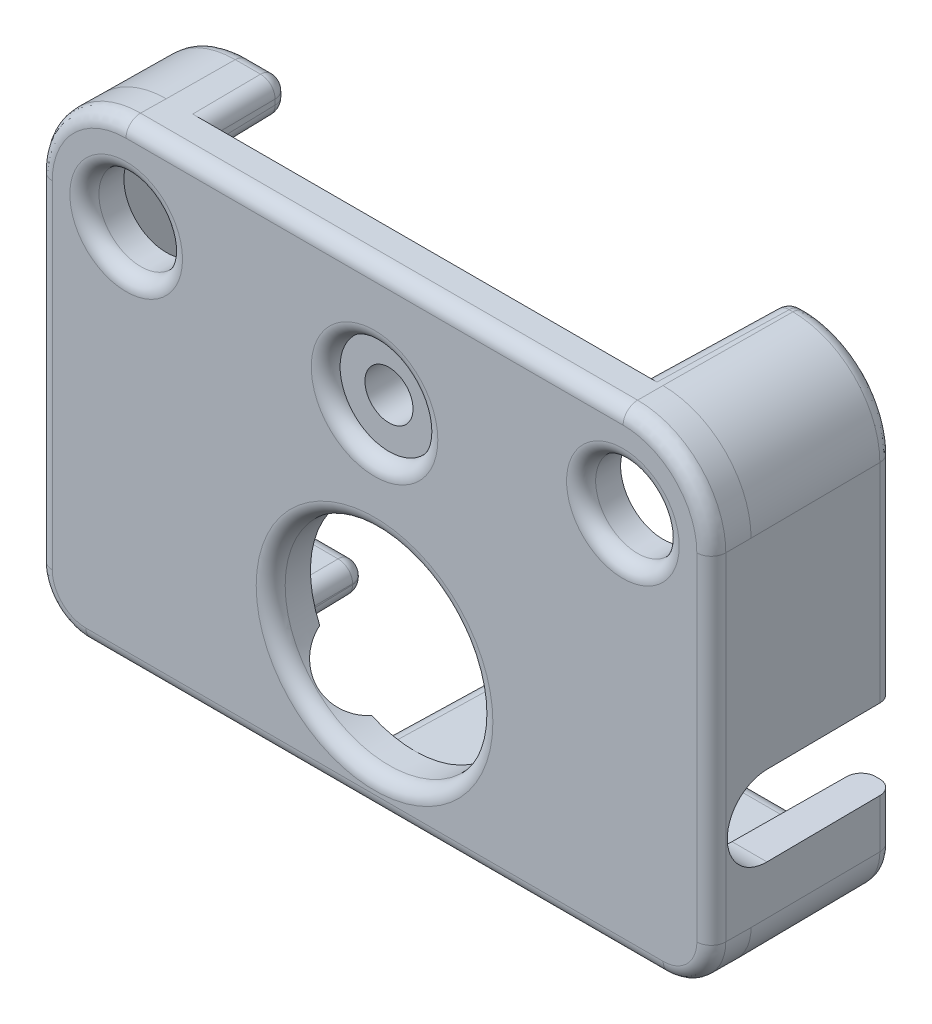
from build123d import *

# Parameters (mm, degrees)
SKETCH1_R                     = 6.5
BOSS_EXTRUDE1_DEPTH           = 2.5
BOSS_EXTRUDE1_DRAFT           = -0.5000000000000011
SKETCH3_W                     = 62.87617342752603
SKETCH3_H                     = 21.84169040460046
CUT_EXTRUDE2_DEPTH            = 30.83426878966247
CUT_EXTRUDE2_DRAFT            = -1.0000000000000022
FILLET1_R                     = 5.5
FILLET2_R                     = 3
BOSS_EXTRUDE3_DEPTH           = 9
BOSS_EXTRUDE3_TAPER           = 0.5000000000000011
CUT_EXTRUDE11_DEPTH           = 32.061770786974705
CUT_EXTRUDE11_DRAFT           = -1.0000000000000022
SKETCH24_R                    = 1.4999999999999996
CUT_EXTRUDE12_DEPTH           = 32.876066333889995
CUT_EXTRUDE6_DEPTH            = 32.061770786974705
CUT_EXTRUDE6_DRAFT            = -1.0000000000000022
SKETCH19_W                    = 16.058890471302547
SKETCH19_H                    = 16.952410483127878
CUT_EXTRUDE13_DEPTH           = 3.8
CUT_EXTRUDE13_DRAFT           = -1.0000000000000022
FILLET9_R                     = 0.9
SKETCH25_R                    = 2.5
CUT_EXTRUDE14_DEPTH           = 32.051093548038764
CIRPATTERN1_COUNT             = 2
CIRPATTERN1_ANGLE             = 135.0000000000001
CUT_EXTRUDE15_DEPTH           = 31.776133778125132
SKETCH29_R                    = 2.5999999999999996
CUT_EXTRUDE16_DEPTH           = 32.865661942427224
CUT_EXTRUDE16_DRAFT           = 1.0000000000000022
SKETCH29_R_2                  = 2.6000000000000005
CUT_EXTRUDE16_PROFILE_2_DEPTH = 32.865661942427224
CUT_EXTRUDE16_PROFILE_2_DRAFT = 1.0000000000000022
FILLET10_R                    = 0.9
BOSS_EXTRUDE4_DEPTH           = 9.7
FILLET11_R                    = 2
SKETCH32_R                    = 2.5000000000000004
SKETCH32_R_2                  = 1.4999999999999996
BOSS_EXTRUDE5_DEPTH           = 0.6
SKETCH33_R                    = 3.05
CUT_EXTRUDE17_DEPTH           = 0.9
FILLET12_R                    = 0.9


# Some blends are built 0.0001 mm under size
with BuildPart() as part:
    # Sketch1 → Boss-Extrude1 (with draft: the straight prism first)
    with BuildSketch(Plane.XY):
        Polygon((20.999999999999993, -20.999999999999996), (20.999999999999993, 21.000000000000004), (-21.000000000000007, 20.999999999999996), (-21.000000000000007, -21.000000000000004), align=None)
        Circle(SKETCH1_R, mode=Mode.SUBTRACT)
    extrude(amount=BOSS_EXTRUDE1_DEPTH)
    # Boss-Extrude1: the draft: its side faces are tilted about the plane it starts from
    boss_extrude1_sides = [part.faces().sort_by_distance(p)[0] for p in [
        (21, 0, 1.25),
        (0, 21, 1.25),
        (-21, 0, 1.25),
        (0, -21, 1.25),
        (-6.5, 0, 1.25),
    ]]
    draft(boss_extrude1_sides, Plane.XY, BOSS_EXTRUDE1_DRAFT)


with BuildPart() as cut_extrude2_tool:
    # Sketch3 → Cut-Extrude2 (with draft: the straight prism first)
    with BuildSketch(Plane.XY.offset(2.5)):
        with Locations((0.8306648912896311, -19.420845202300228)):
            Rectangle(SKETCH3_W, SKETCH3_H)
    extrude(amount=-CUT_EXTRUDE2_DEPTH)
    # Cut-Extrude2: the draft: its side faces are tilted about the plane it starts from
    cut_extrude2_sides = [cut_extrude2_tool.faces().sort_by_distance(p)[0] for p in [
        (-30.607421822, -19.420845202, -12.917134395),
        (0.830664891, -30.341690405, -12.917134395),
        (32.268751605, -19.420845202, -12.917134395),
        (0.830664891, -8.5, -12.917134395),
    ]]
    draft(cut_extrude2_sides, Plane.XY.offset(2.5), CUT_EXTRUDE2_DRAFT)


with BuildPart() as part_1:
    add(part.part)

    # Cut-Extrude2: cut by cut_extrude2_tool
    add(cut_extrude2_tool.part, mode=Mode.SUBTRACT)

    # Fillet1
    fillet1_edges = [part_1.edges().sort_by_distance(p)[0] for p in [
        (-21.01090858473846, 21.010908584738445, 1.25),
        (21.01090858473844, 21.010908584738456, 1.25),
    ]]
    fillet(fillet1_edges, radius=FILLET1_R)

    # Fillet2
    fillet2_edges = [part_1.edges().sort_by_distance(p)[0] for p in [
        (21.010908584738438, -8.52181883116027, 1.2499999999999998),
        (-21.01090858473846, -8.521818831160273, 1.25),
    ]]
    fillet(fillet2_edges, radius=FILLET2_R)

    # Sketch17 → Boss-Extrude3 (add)
    with BuildSketch(Plane(origin=(0, 0, 0), x_dir=(-1, 0, 0), z_dir=(0, 0, -1))):
        with BuildLine():
            Line((-17.999428850311958, -8.543637662320545), (17.999428850311975, -8.543637662320545))
            add(Edge.make_bspline(
                [(17.999428850311975, -8.543637662320545), (21.00000000000001, -8.543637662320545), (21.00000000000001, -5.542723711457656)],
                knots=[0.46354100007527144, 0.46354100007527144, 0.46354100007527144, 2.034489625915063, 2.034489625915063, 2.034489625915063], degree=2, weights=[1, 0.7070529332927252, 1]))
            Line((21.00000000000001, -5.542723711457656), (21.000000000000007, 15.500209423147039))
            add(Edge.make_bspline(
                [(21.000000000000007, 15.500209423147039), (21.000000000000018, 21), (15.500209423147057, 20.999999999999993)],
                knots=[2.356232566403283, 2.356232566403283, 2.356232566403283, 3.9269527407763043, 3.9269527407763043, 3.9269527407763043], degree=2, weights=[1, 0.707133704620916, 1]))
            Line((15.500209423147057, 20.999999999999993), (-15.500209423147053, 21.000000000000004))
            add(Edge.make_bspline(
                [(-15.500209423147053, 21.000000000000004), (-21.000000000000007, 21.000000000000007), (-20.999999999999996, 15.500209423147046)],
                knots=[2.3562325664032837, 2.3562325664032837, 2.3562325664032837, 3.926952740776305, 3.926952740776305, 3.926952740776305], degree=2, weights=[1, 0.707133704620916, 1]))
            Line((-20.999999999999996, 15.500209423147046), (-20.999999999999993, -5.542723711457658))
            add(Edge.make_bspline(
                [(-20.999999999999993, -5.542723711457658), (-20.999999999999996, -8.543637662320549), (-17.999428850311958, -8.543637662320545)],
                knots=[4.248695681264401, 4.248695681264401, 4.248695681264401, 5.819644307104193, 5.819644307104193, 5.819644307104193], degree=2, weights=[1, 0.707052933292725, 1]))
        make_face()
        with BuildLine():
            Line((-17.8, -6.543637662320546), (17.799999999999997, -6.5436376623205454))
            ThreePointArc((17.799999999999997, -6.5436376623205454), (18.507106781186543, -6.250744443507093), (18.799999999999994, -5.5436376623205454))
            Line((18.799999999999994, -5.5436376623205454), (18.79999999999999, 15.500000000000002))
            ThreePointArc((18.79999999999999, 15.500000000000002), (17.8334523779156, 17.833452377915606), (15.499999999999996, 18.800000000000004))
            Line((15.499999999999996, 18.800000000000004), (-15.500000000000004, 18.799999999999997))
            ThreePointArc((-15.500000000000004, 18.799999999999997), (-17.83345237791561, 17.833452377915606), (-18.800000000000008, 15.499999999999998))
            Line((-18.800000000000008, 15.499999999999998), (-18.8, -5.543637662320545))
            ThreePointArc((-18.8, -5.543637662320545), (-18.50710678118655, -6.250744443507093), (-17.8, -6.543637662320546))
        make_face(mode=Mode.SUBTRACT)
    extrude(amount=BOSS_EXTRUDE3_DEPTH, taper=BOSS_EXTRUDE3_TAPER)


with BuildPart() as cut_extrude11_tool:
    # Sketch23 → Cut-Extrude11 (with draft: the straight prism first)
    with BuildSketch(Plane(origin=(0, 0, 0), x_dir=(-1, 0, 0), z_dir=(0, 0, -1))):
        Polygon((2.085641741126999, -2.299063723318845), (2.085641741126999, -11.23940247514184), (11.845349376722023, -11.23940247514184), (11.845349376722021, -2.299063723318845), align=None)
    extrude(amount=CUT_EXTRUDE11_DEPTH)
    # Cut-Extrude11: the draft: its side faces are tilted about the plane it starts from
    cut_extrude11_sides = [cut_extrude11_tool.faces().sort_by_distance(p)[0] for p in [
        (-2.085641741, -6.769233099, -16.030885393),
        (-6.965495559, -11.239402475, -16.030885393),
        (-11.845349377, -6.769233099, -16.030885393),
        (-6.965495559, -2.299063723, -16.030885393),
    ]]
    draft(cut_extrude11_sides, Plane(origin=(0, 0, 0), x_dir=(-1, 0, 0), z_dir=(0, 0, -1)), CUT_EXTRUDE11_DRAFT)


with BuildPart() as part_2:
    add(part_1.part)

    # Cut-Extrude11: cut by cut_extrude11_tool
    add(cut_extrude11_tool.part, mode=Mode.SUBTRACT)

    # Sketch24 → Cut-Extrude12 (cut, through all)
    with BuildSketch(Plane.XY.offset(2.5)):
        with Locations((0, 13.535319355800587)):
            Circle(SKETCH24_R)
    extrude(amount=-CUT_EXTRUDE12_DEPTH, mode=Mode.SUBTRACT)


with BuildPart() as cut_extrude6_tool:
    # Sketch18 → Cut-Extrude6 (with draft: the straight prism first)
    with BuildSketch(Plane(origin=(0, 0, 0), x_dir=(-1, 0, 0), z_dir=(0, 0, -1))):
        Polygon((-14.22547683463904, 22.291876231555076), (-14.22547683463904, 18.35826976556179), (12.949356305694632, 18.35826976556179), (12.949356305694634, 22.291876231555076), align=None)
    extrude(amount=CUT_EXTRUDE6_DEPTH)
    # Cut-Extrude6: the draft: its side faces are tilted about the plane it starts from
    cut_extrude6_sides = [cut_extrude6_tool.faces().sort_by_distance(p)[0] for p in [
        (14.225476835, 20.325072999, -16.030885393),
        (0.638060264, 18.358269766, -16.030885393),
        (-12.949356306, 20.325072999, -16.030885393),
        (0.638060264, 22.291876232, -16.030885393),
    ]]
    draft(cut_extrude6_sides, Plane(origin=(0, 0, 0), x_dir=(-1, 0, 0), z_dir=(0, 0, -1)), CUT_EXTRUDE6_DRAFT)


with BuildPart() as part_3:
    add(part_2.part)

    # Cut-Extrude6: cut by cut_extrude6_tool
    add(cut_extrude6_tool.part, mode=Mode.SUBTRACT)


with BuildPart() as cut_extrude13_tool:
    # Sketch19 → Cut-Extrude13 (with draft: the straight prism first)
    with BuildSketch(Plane(origin=(0, 0, -5.2), x_dir=(-1, 0, 0), z_dir=(0, 0, -1))):
        with Locations((19.44387887215296, 17.095333041325667)):
            Rectangle(SKETCH19_W, SKETCH19_H)
    extrude(amount=CUT_EXTRUDE13_DEPTH)
    # Cut-Extrude13: the draft: its side faces are tilted about the plane it starts from
    cut_extrude13_sides = [cut_extrude13_tool.faces().sort_by_distance(p)[0] for p in [
        (-11.414433637, 17.095333041, -7.1),
        (-19.443878872, 8.6191278, -7.1),
        (-27.473324108, 17.095333041, -7.1),
        (-19.443878872, 25.571538283, -7.1),
    ]]
    draft(cut_extrude13_sides, Plane(origin=(0, 0, -5.2), x_dir=(-1, 0, 0), z_dir=(0, 0, -1)), CUT_EXTRUDE13_DRAFT)


with BuildPart() as part_4:
    add(part_3.part)

    # Cut-Extrude13: cut by cut_extrude13_tool
    add(cut_extrude13_tool.part, mode=Mode.SUBTRACT)

    # Fillet9
    fillet9_edges = [part_4.edges().sort_by_distance(p)[0] for p in [
        (14.9412862094965, 18.87854181011683, -9),
        (17.88898982445589, 17.888989824455876, -9),
        (18.878541810116833, 4.978181168839719, -9),
        (18.562644227726825, -6.306281890047372, -9),
        (7.935726921613479, -6.622179472437376, -9),
        (-1.928546156773041, -7.543637662320545, -9),
        (8.035441346769456, -8.465095852203714, -9),
        (19.53565368975466, -8.02858959277242, -9),
        (20.921458189883168, 4.978742855844694, -9),
        (19.33363659355802, 19.3336365935581, -9),
        (14.941390921070026, 20.921458189883175, -9),
        (14.382572418992998, 19.900000000000002, -9),
        (-19.53565368845936, -8.028589593573138, -9),
        (-15.000936905693978, -8.465095852203714, -9),
        (-12.002444961075984, -7.543637662320545, -9),
        (-14.901222480537987, -6.622179472437376, -9),
        (-18.562644227726818, -6.306281890047374, -9),
        (-20.921458189883182, 1.5050374207884216, -9),
        (-18.878541810116822, 1.5045804453569742, -9),
        (-6.4781828305230995, 4.26e-15, 2.5),
        (-19.410991209575243, 19.410991209575233, 2.5),
        (-1.243e-14, 21.021817169476897, 2.5),
        (19.410991209575226, 19.41099120957524, 2.5),
        (21.02181716947689, 5.011470271743427, 2.5),
        (20.14300309712553, -7.620964326439605, 2.5),
        (-1.066e-14, -8.5, 2.5),
        (-20.14300309712555, -7.62096432643961, 2.5),
        (-21.021817169476904, 5.0114702717434225, 2.5),
        (-19.9, 8.552798553034501, -9),
        (-14.27016603323421, 20.95462028748805, -5.2),
        (-19.357082223465397, 19.35708222349658, -5.2),
        (-14.27006132166068, 18.845379712511953, -5.2),
        (-17.865540680361082, 17.865540680361107, -5.2),
        (14.304024626816018, 20.960729094941588, -4.5),
        (14.30402462681602, 18.839270905058413, -4.500000000000001),
        (-12.994739474507998, 18.822689856255977, -2.6),
        (-12.994739474507998, 20.977310143744024, -2.6),
        (-13.040122643321366, 19.9, -5.2),
        (-20.954620287488062, 12.059668611454384, -5.2),
        (-18.845379712511935, 12.059563899880867, -5.2),
        (-18.861960761314375, 8.585963176398117, -7.1),
        (-20.938039238685622, 8.585963176398115, -7.1),
        (-11.923897168899002, -6.5829085673789605, -4.5),
        (-11.923897168899003, -8.50436675726213, -4.5),
        (-2.0070939489500192, -6.5829085673789605, -4.5),
        (-2.0070939489500184, -8.504366757262128, -4.5),
    ]]
    fillet(fillet9_edges, radius=FILLET9_R)

    # Sketch25 → Cut-Extrude14 (cut, through all)
    with BuildSketch(Plane(origin=(0, 0, 0), x_dir=(0, 0, -1), z_dir=(1, 0, 0))):
        with Locations(Location((1, 0, 0), (0, 0, 180))):
            Circle(SKETCH25_R)
    cut_extrude14 = extrude(amount=CUT_EXTRUDE14_DEPTH, mode=Mode.SUBTRACT)

    # CirPattern1: Cut-Extrude14 ×2 about axis
    cirpattern1_axis = Axis((0, 0, 0), (0, 0, -1))
    for i in range(1, CIRPATTERN1_COUNT):
        add(cut_extrude14.rotate(cirpattern1_axis, i * CIRPATTERN1_ANGLE / (CIRPATTERN1_COUNT - 1)), mode=Mode.SUBTRACT)

    # Sketch28 → Cut-Extrude15 (cut, through all)
    with BuildSketch(Plane(origin=(0, 0, -1), x_dir=(-1, 0, 0), z_dir=(0, 0, -1))):
        Polygon((0, 2.5), (-25.550215905546782, 2.499999999999997), (-25.550215905546782, -2.500000000000003), (0, -2.5), align=None)
    extrude(amount=CUT_EXTRUDE15_DEPTH, mode=Mode.SUBTRACT)


with BuildPart() as cut_extrude16_tool:
    # Sketch29 → Cut-Extrude16 (with draft: the straight prism first)
    with BuildSketch(Plane.XY.offset(2.5)):
        with Locations((-15.5, 15.33531935580059)):
            Circle(SKETCH29_R)
    extrude(amount=-CUT_EXTRUDE16_DEPTH)
    # Cut-Extrude16: the draft: its side faces are tilted about the plane it starts from
    cut_extrude16_sides = [cut_extrude16_tool.faces().sort_by_distance(p)[0] for p in [
        (-18.1, 15.335319356, -13.932830971),
    ]]
    draft(cut_extrude16_sides, Plane.XY.offset(2.5), CUT_EXTRUDE16_DRAFT)


with BuildPart() as part_5:
    add(part_4.part)

    # Cut-Extrude16: cut by cut_extrude16_tool
    add(cut_extrude16_tool.part, mode=Mode.SUBTRACT)


with BuildPart() as cut_extrude16_profile_2_tool:
    # Sketch29 → Cut-Extrude16 profile 2 (with draft: the straight prism first)
    with BuildSketch(Plane.XY.offset(2.5)):
        with Locations((15.500000000000004, 15.335319355800555)):
            Circle(SKETCH29_R_2)
    extrude(amount=-CUT_EXTRUDE16_PROFILE_2_DEPTH)
    # Cut-Extrude16 profile 2: the draft: its side faces are tilted about the plane it starts from
    cut_extrude16_profile_2_sides = [cut_extrude16_profile_2_tool.faces().sort_by_distance(p)[0] for p in [
        (12.9, 15.335319356, -13.932830971),
    ]]
    draft(cut_extrude16_profile_2_sides, Plane.XY.offset(2.5), CUT_EXTRUDE16_PROFILE_2_DRAFT)


with BuildPart() as part_6:
    add(part_5.part)

    # Cut-Extrude16 profile 2: cut by cut_extrude16_profile_2_tool
    add(cut_extrude16_profile_2_tool.part, mode=Mode.SUBTRACT)

    # Fillet10
    fillet10_edges = [part_6.edges().sort_by_distance(p)[0] for p in [
        (-18.1, 15.335319355800591, 2.5),
        (12.900000000000002, 15.335319355800555, 2.5),
    ]]
    fillet(fillet10_edges, radius=FILLET10_R)

    # Sketch30 → Boss-Extrude4 (add)
    with BuildSketch(Plane(origin=(0, 8, 0), x_dir=(1, 0, 0), z_dir=(0, 1, 0))):
        with BuildLine():
            Line((12.45639046570901, -0.9853119776857858), (5.968988704145748, -0.9853119776857872))
            ThreePointArc((5.968988704145748, -0.9853119776857872), (9.212689584927379, 1.199999999999997), (12.45639046570901, -0.9853119776857858))
        make_face()
    extrude(amount=BOSS_EXTRUDE4_DEPTH)

    # Fillet11
    # the kernel refuses this fillet: 2 mm, written as the material it takes off along each edge
    with BuildSketch(Plane(origin=(9.212689584927379, 17.7, 2.3000000000000016), x_dir=(-0.7569079543529857, 0, 0.6535214982211208), z_dir=(0.6535214982211208, 0, 0.7569079543529857))) as fillet11_piece_1_section:
        with BuildLine():
            CenterArc((3.4999999999999987 - FILLET11_R, FILLET11_R), FILLET11_R, 270, 90)
            Line((3.4999999999999996, FILLET11_R), (3.4999999999999987, 0))
            Line((3.4999999999999987, 0), (3.4999999999999987 - FILLET11_R, 0))
        make_face()
    fillet11_piece_1 = revolve(axis=Axis((9.212689584927379, 17.7, 2.3000000000000016), (0, -1, 0)), revolution_arc=261.6152739338455, mode=Mode.PRIVATE)
    fillet11_piece_1 = split(fillet11_piece_1, bisect_by=Plane(origin=(9.212689584927379, 17.7, 0), z_dir=(0, 0, -1)), keep=Keep.TOP, mode=Mode.PRIVATE)
    add(fillet11_piece_1, mode=Mode.SUBTRACT)
    with BuildSketch(Plane(origin=(9.212689584927379, 8, 2.3000000000000016), x_dir=(-0.7569079543529857, 0, 0.6535214982211208), z_dir=(0.6535214982211208, 0, 0.7569079543529857))) as fillet11_piece_2_section:
        with BuildLine():
            CenterArc((3.4999999999999987 - FILLET11_R, -FILLET11_R), FILLET11_R, 0, 90)
            Line((3.4999999999999987 - FILLET11_R, 0), (3.4999999999999987, 0))
            Line((3.4999999999999987, 0), (3.4999999999999987, -FILLET11_R))
        make_face()
    fillet11_piece_2 = revolve(axis=Axis((9.212689584927379, 8, 2.3000000000000016), (0, -1, 0)), revolution_arc=261.6152739338455, mode=Mode.PRIVATE)
    fillet11_piece_2 = split(fillet11_piece_2, bisect_by=Plane(origin=(9.212689584927379, 8, 0), z_dir=(0, 0, -1)), keep=Keep.TOP, mode=Mode.PRIVATE)
    add(fillet11_piece_2, mode=Mode.SUBTRACT)

    # Sketch32 → Boss-Extrude5 (add)
    with BuildSketch(Plane(origin=(0, 0, 0), x_dir=(-1, 0, 0), z_dir=(0, 0, -1))):
        with Locations(Location((0, 13.535319355800587, 0), (0, 0, 180))):
            Circle(SKETCH32_R)
        with Locations(Location((0, 13.535319355800587, 0), (0, 0, 180))):
            Circle(SKETCH32_R_2, mode=Mode.SUBTRACT)
    extrude(amount=BOSS_EXTRUDE5_DEPTH)

    # Sketch33 → Cut-Extrude17 (cut)
    with BuildSketch(Plane.XY.offset(2.5)):
        with Locations((0, 13.535319355800587)):
            Circle(SKETCH33_R)
    extrude(amount=-CUT_EXTRUDE17_DEPTH, mode=Mode.SUBTRACT)

    # Fillet12
    fillet12_edges = [part_6.edges().sort_by_distance(p)[0] for p in [
        (-3.05, 13.535319355800587, 2.5),
    ]]
    fillet(fillet12_edges, radius=FILLET12_R - 0.0001)  # a hair under: the kernel refuses the full size


solid = part_6.part
